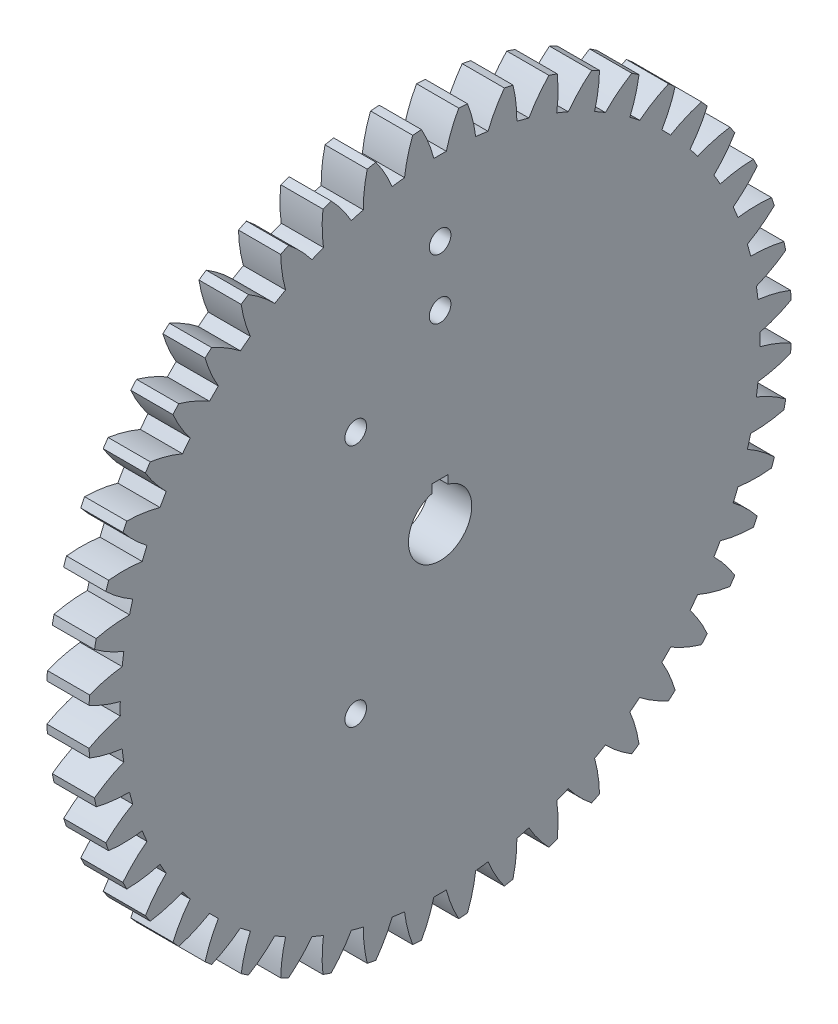
from build123d import *

# Parameters (mm, degrees)
BASPROSKE_W        = 12.7
BASPROSKE_H        = 105.833333333
TOOTHCUT_DEPTH     = 151.208784327
TEETHCUTS_COUNT    = 48
TEETHCUTS_ANGLE    = 352.5
BORSKE_R           = 9.525
BORE_DEPTH         = 50.8000508
KEYSKE_W           = 4.7625
KEYSKE_H           = 11.7348
KEYWAY_DEPTH       = 50.8000508
SKETCH1_R          = 3.2512
CUT_EXTRUDE1_DEPTH = 150.999487388
SKETCH2_R          = 3.2512
CUT_EXTRUDE2_DEPTH = 150.999487388


with BuildPart() as part:
    # BasProSke → Base-Revolve (revolve)
    with BuildSketch(Plane(origin=(0, 0, 0), x_dir=(1, 0, 0), z_dir=(0, 1, 0))):
        with Locations((6.35, 52.916666667)):
            Rectangle(BASPROSKE_W, BASPROSKE_H)
    revolve(axis=Axis((-10, 0, 0), (1, 0, 0)))

    # TooCutSke → ToothCut (cut, through all)
    with BuildSketch(Plane(origin=(0, 0, 0), x_dir=(0, 0, -1), z_dir=(1, 0, 0))):
        with BuildLine():
            ThreePointArc((1.876846967, 96.288773454), (0, 96.307063333), (-1.876846967, 96.288773454))
            ThreePointArc((-1.876846967, 96.288773454), (-3.452860298, 101.11626516), (-5.618618136, 105.70951969))
            ThreePointArc((-5.618618136, 105.70951969), (0, 105.858733333), (5.618618136, 105.70951969))
            ThreePointArc((5.618618136, 105.70951969), (3.452860298, 101.11626516), (1.876846967, 96.288773454))
        make_face()
    toothcut = extrude(amount=TOOTHCUT_DEPTH, mode=Mode.SUBTRACT)

    # TeethCuts: ToothCut ×48 about axis
    teethcuts_axis = Axis((-10, 0, 0), (1, 0, 0))
    for i in range(1, TEETHCUTS_COUNT):
        add(toothcut.rotate(teethcuts_axis, i * TEETHCUTS_ANGLE / (TEETHCUTS_COUNT - 1)), mode=Mode.SUBTRACT)

    # BorSke → Bore (cut, symmetric)
    with BuildSketch(Plane(origin=(0, 0, 0), x_dir=(0, 0, -1), z_dir=(1, 0, 0))):
        Circle(BORSKE_R)
    extrude(amount=BORE_DEPTH, both=True, mode=Mode.SUBTRACT)

    # KeySke → Keyway (cut, symmetric)
    with BuildSketch(Plane(origin=(0, 0, 0), x_dir=(0, 0, -1), z_dir=(1, 0, 0))):
        with Locations((0, 5.8674)):
            Rectangle(KEYSKE_W, KEYSKE_H)
    extrude(amount=KEYWAY_DEPTH, both=True, mode=Mode.SUBTRACT)

    # Sketch1 → Cut-Extrude1 (cut, through all)
    with BuildSketch(Plane.ZY):
        with Locations((0, 73.7743)):
            Circle(SKETCH1_R)
        with Locations((0, 55.7657)):
            Circle(SKETCH1_R)
    extrude(amount=-CUT_EXTRUDE1_DEPTH, mode=Mode.SUBTRACT)

    # Sketch2 → Cut-Extrude2 (cut, through all)
    with BuildSketch(Plane.ZY):
        with Locations((25.4, -36.703)):
            Circle(SKETCH2_R)
        with Locations((25.4, 36.703)):
            Circle(SKETCH2_R)
    extrude(amount=-CUT_EXTRUDE2_DEPTH, mode=Mode.SUBTRACT)


solid = part.part
